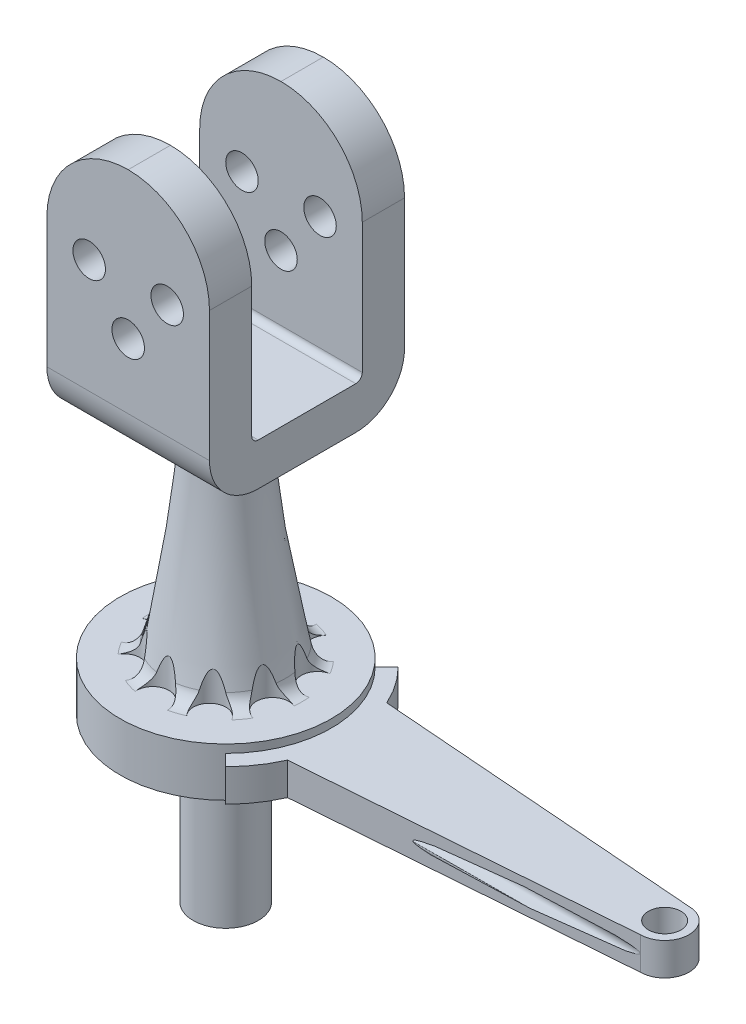
from build123d import *

# Parameters (mm, degrees)
SKETCH2_R           = 5
CUT_EXTRUDE1_DEPTH  = 70
CIRPATTERN1_COUNT   = 10
EXTRUDE_THIN1_DEPTH = 25
FILLET1_R           = 25
SKETCH4_R           = 5
CUT_EXTRUDE2_DEPTH  = 112
EXTRUDE_THIN2_START = -2.5
EXTRUDE_THIN2_DEPTH = 10
SKETCH7_R           = 5
BOSS_EXTRUDE1_DEPTH = 10
SKETCH5_R           = 2.5
CUT_EXTRUDE3_DEPTH  = 193


with BuildPart() as part:
    # Sketch1 → Revolve1 (revolve)
    with BuildSketch(Plane(origin=(0, 0, 0), x_dir=(0, 0, -1), z_dir=(1, 0, 0))):
        with BuildLine():
            Line((0, 0), (10, 0))
            Line((10, 0), (10, 50))
            Line((10, 50), (32.5, 50))
            Line((32.5, 50), (32.5, 65))
            Line((32.5, 65), (23.455506402, 65))
            ThreePointArc((23.455506402, 65), (20.342765879, 66.08709233), (18.583559895, 68.875661427))
            ThreePointArc((18.583559895, 68.875661427), (12.957020086, 99.250393246), (10, 130))
            Line((10, 130), (0, 130))
            Line((0, 130), (0, 0))
        make_face()
    revolve(axis=Axis((0, 0, 0), (0, 1, 0)))

    # Sketch2 → Cut-Extrude1 (cut)
    with BuildSketch(Plane(origin=(0, 65, 0), x_dir=(1, 0, 0), z_dir=(0, 1, 0))):
        with Locations((0, 22.41476923)):
            Circle(SKETCH2_R)
    cut_extrude1 = extrude(amount=CUT_EXTRUDE1_DEPTH, mode=Mode.SUBTRACT)

    # CirPattern1: Cut-Extrude1 ×10 about axis
    cirpattern1_axis = Axis((0, 0, 0), (0, 1, 0))
    for i in range(1, CIRPATTERN1_COUNT):
        add(cut_extrude1.rotate(cirpattern1_axis, i * 360 / CIRPATTERN1_COUNT), mode=Mode.SUBTRACT)

    # Sketch3 → Extrude-Thin1 (add, symmetric)
    with BuildSketch(Plane(origin=(0, 0, 0), x_dir=(0, 0, -1), z_dir=(1, 0, 0))):
        with BuildLine():
            Line((30, 210), (30, 145))
            ThreePointArc((30, 145), (25.606601718, 134.393398282), (15, 130))
            Line((15, 130), (-15, 130))
            ThreePointArc((-15, 130), (-25.606601718, 134.393398282), (-30, 145))
            Line((-30, 145), (-30, 210))
            Line((-30, 210), (-17, 210))
            Line((-17, 210), (-17, 145))
            ThreePointArc((-17, 145), (-16.414213562, 143.585786438), (-15, 143))
            Line((-15, 143), (15, 143))
            ThreePointArc((15, 143), (16.414213562, 143.585786438), (17, 145))
            Line((17, 145), (17, 210))
            Line((17, 210), (30, 210))
        make_face()
    extrude(amount=EXTRUDE_THIN1_DEPTH, both=True)

    # Fillet1
    fillet1_edges = [part.edges().sort_by_distance(p)[0] for p in [
        (25, 210, 23.5),
        (-25, 210, 23.5),
        (-25, 210, -23.5),
        (25, 210, -23.5),
    ]]
    fillet(fillet1_edges, radius=FILLET1_R - 0.0001)  # a hair under: the kernel refuses the full size

    # Sketch4 → Cut-Extrude2 (cut)
    with BuildSketch(Plane(origin=(0, 0, -30), x_dir=(-1, 0, 0), z_dir=(0, 0, -1))):
        with Locations(Location((0, 165, 0), (0, 0, 90))):
            Circle(SKETCH4_R)
        with Locations(Location((-12, 180, 0), (0, 0, 90))):
            Circle(SKETCH4_R)
        with Locations(Location((12, 180, 0), (0, 0, 90))):
            Circle(SKETCH4_R)
    extrude(amount=-CUT_EXTRUDE2_DEPTH, mode=Mode.SUBTRACT)

    # Sketch6 → Extrude-Thin2 (add)
    with BuildSketch(Plane(origin=(0, 65, 0), x_dir=(1, 0, 0), z_dir=(0, 1, 0)).offset(EXTRUDE_THIN2_START)):
        with BuildLine():
            ThreePointArc((22.980970389, -22.980970389), (32.5, 0), (22.980970389, 22.980970389))
            Line((22.980970389, 22.980970389), (26.516504294, 26.516504294))
            ThreePointArc((26.516504294, 26.516504294), (37.5, 0), (26.516504294, -26.516504294))
            Line((26.516504294, -26.516504294), (22.980970389, -22.980970389))
        make_face()
    extrude(amount=-EXTRUDE_THIN2_DEPTH)

    # Sketch7 → Boss-Extrude1 (add)
    with BuildSketch(Plane(origin=(0, 62.5, 0), x_dir=(1, 0, 0), z_dir=(0, 1, 0))):
        with BuildLine():
            Line((135, 7.5), (34.256122138, 15.256739365))
            ThreePointArc((34.256122138, 15.256739365), (37.5, 0), (34.256122138, -15.256739365))
            Line((34.256122138, -15.256739365), (135, -7.5))
            ThreePointArc((135, -7.5), (142.5, 0), (135, 7.5))
        make_face()
        with Locations(Location((135, 0, 0), (0, 0, 270))):
            Circle(SKETCH7_R, mode=Mode.SUBTRACT)
    extrude(amount=-BOSS_EXTRUDE1_DEPTH)

    # Sketch5 → Cut-Extrude3 (cut, symmetric)
    with BuildSketch(Plane(origin=(0, 0, 0), x_dir=(0, 0, -1), z_dir=(1, 0, 0))):
        with Locations((10, 57.5)):
            Circle(SKETCH5_R)
        with Locations((-10, 57.5)):
            Circle(SKETCH5_R)
    extrude(amount=CUT_EXTRUDE3_DEPTH, both=True, mode=Mode.SUBTRACT)


solid = part.part
